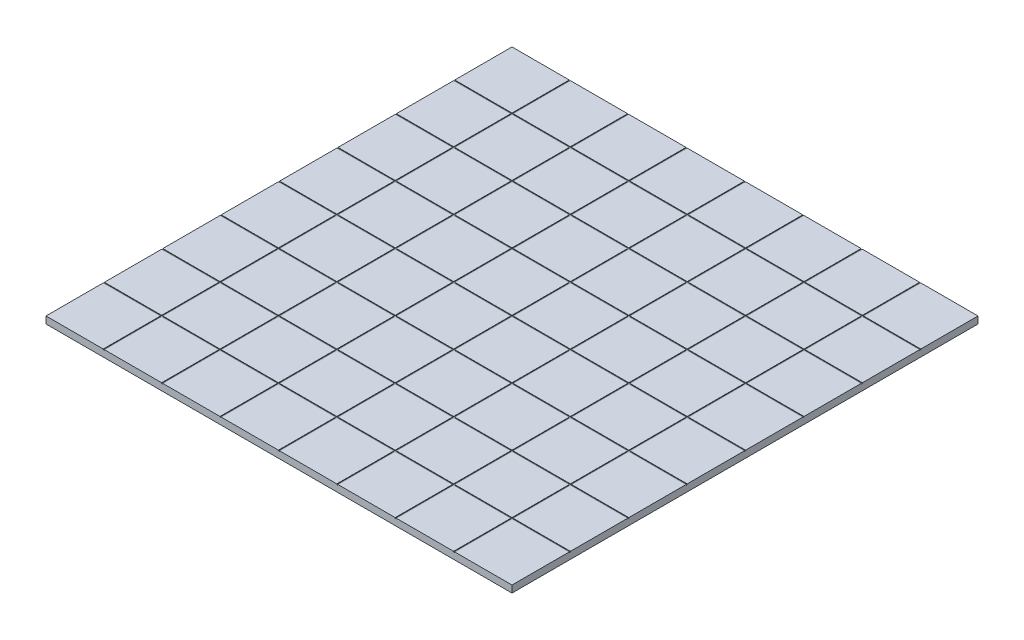
from build123d import *

# Parameters (mm, degrees)
SKETCH1_W           = 200
SKETCH1_H           = 200
BOSS_EXTRUDE1_DEPTH = 3
SKETCH2_W           = 24.5625
SKETCH2_H           = 24.5625
CUT_EXTRUDE1_DEPTH  = 0.25
SKETCH4_W           = 4.4
SKETCH4_H           = 3.5
SKETCH4_W_2         = 3.9
SKETCH4_H_2         = 3
SKETCH4_W_3         = 1.95
SKETCH4_H_3         = 1.5
CUT_EXTRUDE2_DEPTH  = 1.5
SKETCH7_W           = 4.4
SKETCH7_H           = 3.5
SKETCH7_W_2         = 3.4
SKETCH7_H_2         = 2.5
CUT_EXTRUDE4_DEPTH  = 1.25
SKETCH8_W           = 4.5
SKETCH8_H           = 3.74
SKETCH8_W_2         = 4
SKETCH8_H_2         = 3.24
CUT_EXTRUDE5_DEPTH  = 2.75


with BuildPart() as part:
    # Sketch1 → Boss-Extrude1 (new body)
    with BuildSketch(Plane(origin=(0, 0, 0), x_dir=(1, 0, 0), z_dir=(0, 1, 0))):
        with Locations((100, 100)):
            Rectangle(SKETCH1_W, SKETCH1_H)
    extrude(amount=BOSS_EXTRUDE1_DEPTH)

    # Sketch2 → Cut-Extrude1 (cut)
    with BuildSketch(Plane(origin=(0, 3, 0), x_dir=(1, 0, 0), z_dir=(0, 1, 0))):
        Polygon((150.375, 24.5625), (174.9375, 24.5625), (174.9375, 0), (175.4375, 0), (175.4375, 24.5625), (200, 24.5625), (200, 25.0625), (175.4375, 25.0625), (175.4375, 49.625), (200, 49.625), (200, 50.125), (175.4375, 50.125), (175.4375, 74.6875), (200, 74.6875), (200, 75.1875), (175.4375, 75.1875), (175.4375, 99.75), (200, 99.75), (200, 100.25), (175.4375, 100.25), (175.4375, 124.8125), (200, 124.8125), (200, 125.3125), (175.4375, 125.3125), (175.4375, 149.875), (200, 149.875), (200, 150.375), (175.4375, 150.375), (175.4375, 174.9375), (200, 174.9375), (200, 175.4375), (175.4375, 175.4375), (175.4375, 200), (174.9375, 200), (174.9375, 175.4375), (150.375, 175.4375), (150.375, 200), (149.875, 200), (149.875, 175.4375), (125.3125, 175.4375), (125.3125, 200), (124.8125, 200), (124.8125, 175.4375), (100.25, 175.4375), (100.25, 200), (99.75, 200), (99.75, 175.4375), (75.1875, 175.4375), (75.1875, 200), (74.6875, 200), (74.6875, 175.4375), (50.125, 175.4375), (50.125, 200), (49.625, 200), (49.625, 175.4375), (25.0625, 175.4375), (25.0625, 200), (24.5625, 200), (24.5625, 175.4375), (0, 175.4375), (0, 174.9375), (24.5625, 174.9375), (24.5625, 150.375), (0, 150.375), (0, 149.875), (24.5625, 149.875), (24.5625, 125.3125), (0, 125.3125), (0, 124.8125), (24.5625, 124.8125), (24.5625, 100.25), (0, 100.25), (0, 99.75), (24.5625, 99.75), (24.5625, 75.1875), (0, 75.1875), (0, 74.6875), (24.5625, 74.6875), (24.5625, 50.125), (0, 50.125), (0, 49.625), (24.5625, 49.625), (24.5625, 25.0625), (0, 25.0625), (0, 24.5625), (24.5625, 24.5625), (24.5625, 0), (25.0625, 0), (25.0625, 24.5625), (49.625, 24.5625), (49.625, 0), (50.125, 0), (50.125, 24.5625), (74.6875, 24.5625), (74.6875, 0), (75.1875, 0), (75.1875, 24.5625), (99.75, 24.5625), (99.75, 0), (100.25, 0), (100.25, 24.5625), (124.8125, 24.5625), (124.8125, 0), (125.3125, 0), (125.3125, 24.5625), (149.875, 24.5625), (149.875, 0), (150.375, 0), align=None)
        with Locations((37.34375, 37.34375)):
            Rectangle(SKETCH2_W, SKETCH2_H, mode=Mode.SUBTRACT)
        with Locations((62.40625, 37.34375)):
            Rectangle(SKETCH2_W, SKETCH2_H, mode=Mode.SUBTRACT)
        with Locations((37.34375, 62.40625)):
            Rectangle(SKETCH2_W, SKETCH2_H, mode=Mode.SUBTRACT)
        with Locations((62.40625, 62.40625)):
            Rectangle(SKETCH2_W, SKETCH2_H, mode=Mode.SUBTRACT)
        with Locations((87.46875, 37.34375)):
            Rectangle(SKETCH2_W, SKETCH2_H, mode=Mode.SUBTRACT)
        with Locations((87.46875, 62.40625)):
            Rectangle(SKETCH2_W, SKETCH2_H, mode=Mode.SUBTRACT)
        with Locations((37.34375, 87.46875)):
            Rectangle(SKETCH2_W, SKETCH2_H, mode=Mode.SUBTRACT)
        with Locations((62.40625, 87.46875)):
            Rectangle(SKETCH2_W, SKETCH2_H, mode=Mode.SUBTRACT)
        with Locations((87.46875, 87.46875)):
            Rectangle(SKETCH2_W, SKETCH2_H, mode=Mode.SUBTRACT)
        with Locations((112.53125, 37.34375)):
            Rectangle(SKETCH2_W, SKETCH2_H, mode=Mode.SUBTRACT)
        with Locations((112.53125, 62.40625)):
            Rectangle(SKETCH2_W, SKETCH2_H, mode=Mode.SUBTRACT)
        with Locations((137.59375, 37.34375)):
            Rectangle(SKETCH2_W, SKETCH2_H, mode=Mode.SUBTRACT)
        with Locations((162.65625, 37.34375)):
            Rectangle(SKETCH2_W, SKETCH2_H, mode=Mode.SUBTRACT)
        with Locations((137.59375, 62.40625)):
            Rectangle(SKETCH2_W, SKETCH2_H, mode=Mode.SUBTRACT)
        with Locations((162.65625, 62.40625)):
            Rectangle(SKETCH2_W, SKETCH2_H, mode=Mode.SUBTRACT)
        with Locations((112.53125, 87.46875)):
            Rectangle(SKETCH2_W, SKETCH2_H, mode=Mode.SUBTRACT)
        with Locations((137.59375, 87.46875)):
            Rectangle(SKETCH2_W, SKETCH2_H, mode=Mode.SUBTRACT)
        with Locations((162.65625, 87.46875)):
            Rectangle(SKETCH2_W, SKETCH2_H, mode=Mode.SUBTRACT)
        with Locations((37.34375, 112.53125)):
            Rectangle(SKETCH2_W, SKETCH2_H, mode=Mode.SUBTRACT)
        with Locations((62.40625, 112.53125)):
            Rectangle(SKETCH2_W, SKETCH2_H, mode=Mode.SUBTRACT)
        with Locations((87.46875, 112.53125)):
            Rectangle(SKETCH2_W, SKETCH2_H, mode=Mode.SUBTRACT)
        with Locations((37.34375, 137.59375)):
            Rectangle(SKETCH2_W, SKETCH2_H, mode=Mode.SUBTRACT)
        with Locations((62.40625, 137.59375)):
            Rectangle(SKETCH2_W, SKETCH2_H, mode=Mode.SUBTRACT)
        with Locations((37.34375, 162.65625)):
            Rectangle(SKETCH2_W, SKETCH2_H, mode=Mode.SUBTRACT)
        with Locations((62.40625, 162.65625)):
            Rectangle(SKETCH2_W, SKETCH2_H, mode=Mode.SUBTRACT)
        with Locations((87.46875, 137.59375)):
            Rectangle(SKETCH2_W, SKETCH2_H, mode=Mode.SUBTRACT)
        with Locations((87.46875, 162.65625)):
            Rectangle(SKETCH2_W, SKETCH2_H, mode=Mode.SUBTRACT)
        with Locations((112.53125, 112.53125)):
            Rectangle(SKETCH2_W, SKETCH2_H, mode=Mode.SUBTRACT)
        with Locations((137.59375, 112.53125)):
            Rectangle(SKETCH2_W, SKETCH2_H, mode=Mode.SUBTRACT)
        with Locations((162.65625, 112.53125)):
            Rectangle(SKETCH2_W, SKETCH2_H, mode=Mode.SUBTRACT)
        with Locations((112.53125, 137.59375)):
            Rectangle(SKETCH2_W, SKETCH2_H, mode=Mode.SUBTRACT)
        with Locations((112.53125, 162.65625)):
            Rectangle(SKETCH2_W, SKETCH2_H, mode=Mode.SUBTRACT)
        with Locations((137.59375, 137.59375)):
            Rectangle(SKETCH2_W, SKETCH2_H, mode=Mode.SUBTRACT)
        with Locations((162.65625, 137.59375)):
            Rectangle(SKETCH2_W, SKETCH2_H, mode=Mode.SUBTRACT)
        with Locations((137.59375, 162.65625)):
            Rectangle(SKETCH2_W, SKETCH2_H, mode=Mode.SUBTRACT)
        with Locations((162.65625, 162.65625)):
            Rectangle(SKETCH2_W, SKETCH2_H, mode=Mode.SUBTRACT)
    extrude(amount=-CUT_EXTRUDE1_DEPTH, mode=Mode.SUBTRACT)

    # Sketch4 → Cut-Extrude2 (cut)
    # profile 1 of 68: a face of its own
    with BuildSketch(Plane.XZ):
        with Locations((37.3425, -162.6575)):
            Rectangle(SKETCH4_W, SKETCH4_H)
    # profile 2 of 68: a face of its own
    with BuildSketch(Plane.XZ):
        with Locations((12.28, -162.6575)):
            Rectangle(SKETCH4_W, SKETCH4_H)
    # profile 3 of 68: a face of its own
    with BuildSketch(Plane.XZ):
        with Locations((12.28, -187.72)):
            Rectangle(SKETCH4_W, SKETCH4_H)
        with Locations((12.28, -187.72)):
            Rectangle(SKETCH4_W_2, SKETCH4_H_2, mode=Mode.SUBTRACT)
    # profile 4 of 68: a face of its own
    with BuildSketch(Plane.XZ):
        with Locations((13.255, -188.47)):
            Rectangle(SKETCH4_W_3, SKETCH4_H_3)
    # profile 5 of 68: a face of its own
    with BuildSketch(Plane.XZ):
        with Locations((13.255, -186.97)):
            Rectangle(SKETCH4_W_3, SKETCH4_H_3)
    # profile 6 of 68: a face of its own
    with BuildSketch(Plane.XZ):
        with Locations((11.305, -186.97)):
            Rectangle(SKETCH4_W_3, SKETCH4_H_3)
    # profile 7 of 68: a face of its own
    with BuildSketch(Plane.XZ):
        with Locations((11.305, -188.47)):
            Rectangle(SKETCH4_W_3, SKETCH4_H_3)
    # profile 8 of 68: a face of its own
    with BuildSketch(Plane.XZ):
        with Locations((37.3425, -187.72)):
            Rectangle(SKETCH4_W, SKETCH4_H)
    # profile 9 of 68: a face of its own
    with BuildSketch(Plane.XZ):
        with Locations((62.405, -187.72)):
            Rectangle(SKETCH4_W, SKETCH4_H)
    # profile 10 of 68: a face of its own
    with BuildSketch(Plane.XZ):
        with Locations((87.4675, -187.72)):
            Rectangle(SKETCH4_W, SKETCH4_H)
    # profile 11 of 68: a face of its own
    with BuildSketch(Plane.XZ):
        with Locations((112.53, -187.72)):
            Rectangle(SKETCH4_W, SKETCH4_H)
    # profile 12 of 68: a face of its own
    with BuildSketch(Plane.XZ):
        with Locations((137.5925, -187.72)):
            Rectangle(SKETCH4_W, SKETCH4_H)
    # profile 13 of 68: a face of its own
    with BuildSketch(Plane.XZ):
        with Locations((162.655, -187.72)):
            Rectangle(SKETCH4_W, SKETCH4_H)
    # profile 14 of 68: a face of its own
    with BuildSketch(Plane.XZ):
        with Locations((187.7175, -187.72)):
            Rectangle(SKETCH4_W, SKETCH4_H)
    # profile 15 of 68: a face of its own
    with BuildSketch(Plane.XZ):
        with Locations((187.7175, -162.6575)):
            Rectangle(SKETCH4_W, SKETCH4_H)
    # profile 16 of 68: a face of its own
    with BuildSketch(Plane.XZ):
        with Locations((162.655, -162.6575)):
            Rectangle(SKETCH4_W, SKETCH4_H)
    # profile 17 of 68: a face of its own
    with BuildSketch(Plane.XZ):
        with Locations((137.5925, -162.6575)):
            Rectangle(SKETCH4_W, SKETCH4_H)
    # profile 18 of 68: a face of its own
    with BuildSketch(Plane.XZ):
        with Locations((112.53, -162.6575)):
            Rectangle(SKETCH4_W, SKETCH4_H)
    # profile 19 of 68: a face of its own
    with BuildSketch(Plane.XZ):
        with Locations((87.4675, -162.6575)):
            Rectangle(SKETCH4_W, SKETCH4_H)
    # profile 20 of 68: a face of its own
    with BuildSketch(Plane.XZ):
        with Locations((62.405, -162.6575)):
            Rectangle(SKETCH4_W, SKETCH4_H)
    # profile 21 of 68: a face of its own
    with BuildSketch(Plane.XZ):
        with Locations((12.28, -137.595)):
            Rectangle(SKETCH4_W, SKETCH4_H)
    # profile 22 of 68: a face of its own
    with BuildSketch(Plane.XZ):
        with Locations((37.3425, -137.595)):
            Rectangle(SKETCH4_W, SKETCH4_H)
    # profile 23 of 68: a face of its own
    with BuildSketch(Plane.XZ):
        with Locations((62.405, -137.595)):
            Rectangle(SKETCH4_W, SKETCH4_H)
    # profile 24 of 68: a face of its own
    with BuildSketch(Plane.XZ):
        with Locations((87.4675, -137.595)):
            Rectangle(SKETCH4_W, SKETCH4_H)
    # profile 25 of 68: a face of its own
    with BuildSketch(Plane.XZ):
        with Locations((112.53, -137.595)):
            Rectangle(SKETCH4_W, SKETCH4_H)
    # profile 26 of 68: a face of its own
    with BuildSketch(Plane.XZ):
        with Locations((137.5925, -137.595)):
            Rectangle(SKETCH4_W, SKETCH4_H)
    # profile 27 of 68: a face of its own
    with BuildSketch(Plane.XZ):
        with Locations((162.655, -137.595)):
            Rectangle(SKETCH4_W, SKETCH4_H)
    # profile 28 of 68: a face of its own
    with BuildSketch(Plane.XZ):
        with Locations((187.7175, -137.595)):
            Rectangle(SKETCH4_W, SKETCH4_H)
    # profile 29 of 68: a face of its own
    with BuildSketch(Plane.XZ):
        with Locations((187.7175, -112.5325)):
            Rectangle(SKETCH4_W, SKETCH4_H)
    # profile 30 of 68: a face of its own
    with BuildSketch(Plane.XZ):
        with Locations((162.655, -112.5325)):
            Rectangle(SKETCH4_W, SKETCH4_H)
    # profile 31 of 68: a face of its own
    with BuildSketch(Plane.XZ):
        with Locations((137.5925, -112.5325)):
            Rectangle(SKETCH4_W, SKETCH4_H)
    # profile 32 of 68: a face of its own
    with BuildSketch(Plane.XZ):
        with Locations((112.53, -112.5325)):
            Rectangle(SKETCH4_W, SKETCH4_H)
    # profile 33 of 68: a face of its own
    with BuildSketch(Plane.XZ):
        with Locations((87.4675, -112.5325)):
            Rectangle(SKETCH4_W, SKETCH4_H)
    # profile 34 of 68: a face of its own
    with BuildSketch(Plane.XZ):
        with Locations((62.405, -112.5325)):
            Rectangle(SKETCH4_W, SKETCH4_H)
    # profile 35 of 68: a face of its own
    with BuildSketch(Plane.XZ):
        with Locations((37.3425, -112.5325)):
            Rectangle(SKETCH4_W, SKETCH4_H)
    # profile 36 of 68: a face of its own
    with BuildSketch(Plane.XZ):
        with Locations((12.28, -112.5325)):
            Rectangle(SKETCH4_W, SKETCH4_H)
    # profile 37 of 68: a face of its own
    with BuildSketch(Plane.XZ):
        with Locations((12.28, -87.47)):
            Rectangle(SKETCH4_W, SKETCH4_H)
    # profile 38 of 68: a face of its own
    with BuildSketch(Plane.XZ):
        with Locations((37.3425, -87.47)):
            Rectangle(SKETCH4_W, SKETCH4_H)
    # profile 39 of 68: a face of its own
    with BuildSketch(Plane.XZ):
        with Locations((62.405, -87.47)):
            Rectangle(SKETCH4_W, SKETCH4_H)
    # profile 40 of 68: a face of its own
    with BuildSketch(Plane.XZ):
        with Locations((87.4675, -87.47)):
            Rectangle(SKETCH4_W, SKETCH4_H)
    # profile 41 of 68: a face of its own
    with BuildSketch(Plane.XZ):
        with Locations((112.53, -87.47)):
            Rectangle(SKETCH4_W, SKETCH4_H)
    # profile 42 of 68: a face of its own
    with BuildSketch(Plane.XZ):
        with Locations((137.5925, -87.47)):
            Rectangle(SKETCH4_W, SKETCH4_H)
    # profile 43 of 68: a face of its own
    with BuildSketch(Plane.XZ):
        with Locations((162.655, -87.47)):
            Rectangle(SKETCH4_W, SKETCH4_H)
    # profile 44 of 68: a face of its own
    with BuildSketch(Plane.XZ):
        with Locations((187.7175, -87.47)):
            Rectangle(SKETCH4_W, SKETCH4_H)
    # profile 45 of 68: a face of its own
    with BuildSketch(Plane.XZ):
        with Locations((187.7175, -62.4075)):
            Rectangle(SKETCH4_W, SKETCH4_H)
    # profile 46 of 68: a face of its own
    with BuildSketch(Plane.XZ):
        with Locations((162.655, -62.4075)):
            Rectangle(SKETCH4_W, SKETCH4_H)
    # profile 47 of 68: a face of its own
    with BuildSketch(Plane.XZ):
        with Locations((137.5925, -62.4075)):
            Rectangle(SKETCH4_W, SKETCH4_H)
    # profile 48 of 68: a face of its own
    with BuildSketch(Plane.XZ):
        with Locations((112.53, -62.4075)):
            Rectangle(SKETCH4_W, SKETCH4_H)
    # profile 49 of 68: a face of its own
    with BuildSketch(Plane.XZ):
        with Locations((87.4675, -62.4075)):
            Rectangle(SKETCH4_W, SKETCH4_H)
    # profile 50 of 68: a face of its own
    with BuildSketch(Plane.XZ):
        with Locations((62.405, -62.4075)):
            Rectangle(SKETCH4_W, SKETCH4_H)
    # profile 51 of 68: a face of its own
    with BuildSketch(Plane.XZ):
        with Locations((37.3425, -62.4075)):
            Rectangle(SKETCH4_W, SKETCH4_H)
    # profile 52 of 68: a face of its own
    with BuildSketch(Plane.XZ):
        with Locations((12.28, -62.4075)):
            Rectangle(SKETCH4_W, SKETCH4_H)
    # profile 53 of 68: a face of its own
    with BuildSketch(Plane.XZ):
        with Locations((12.28, -37.345)):
            Rectangle(SKETCH4_W, SKETCH4_H)
    # profile 54 of 68: a face of its own
    with BuildSketch(Plane.XZ):
        with Locations((37.3425, -37.345)):
            Rectangle(SKETCH4_W, SKETCH4_H)
    # profile 55 of 68: a face of its own
    with BuildSketch(Plane.XZ):
        with Locations((62.405, -37.345)):
            Rectangle(SKETCH4_W, SKETCH4_H)
    # profile 56 of 68: a face of its own
    with BuildSketch(Plane.XZ):
        with Locations((87.4675, -37.345)):
            Rectangle(SKETCH4_W, SKETCH4_H)
    # profile 57 of 68: a face of its own
    with BuildSketch(Plane.XZ):
        with Locations((112.53, -37.345)):
            Rectangle(SKETCH4_W, SKETCH4_H)
    # profile 58 of 68: a face of its own
    with BuildSketch(Plane.XZ):
        with Locations((137.5925, -37.345)):
            Rectangle(SKETCH4_W, SKETCH4_H)
    # profile 59 of 68: a face of its own
    with BuildSketch(Plane.XZ):
        with Locations((162.655, -37.345)):
            Rectangle(SKETCH4_W, SKETCH4_H)
    # profile 60 of 68: a face of its own
    with BuildSketch(Plane.XZ):
        with Locations((187.7175, -37.345)):
            Rectangle(SKETCH4_W, SKETCH4_H)
    # profile 61 of 68: a face of its own
    with BuildSketch(Plane.XZ):
        with Locations((187.7175, -12.2825)):
            Rectangle(SKETCH4_W, SKETCH4_H)
    # profile 62 of 68: a face of its own
    with BuildSketch(Plane.XZ):
        with Locations((162.655, -12.2825)):
            Rectangle(SKETCH4_W, SKETCH4_H)
    # profile 63 of 68: a face of its own
    with BuildSketch(Plane.XZ):
        with Locations((137.5925, -12.2825)):
            Rectangle(SKETCH4_W, SKETCH4_H)
    # profile 64 of 68: a face of its own
    with BuildSketch(Plane.XZ):
        with Locations((112.53, -12.2825)):
            Rectangle(SKETCH4_W, SKETCH4_H)
    # profile 65 of 68: a face of its own
    with BuildSketch(Plane.XZ):
        with Locations((87.4675, -12.2825)):
            Rectangle(SKETCH4_W, SKETCH4_H)
    # profile 66 of 68: a face of its own
    with BuildSketch(Plane.XZ):
        with Locations((62.405, -12.2825)):
            Rectangle(SKETCH4_W, SKETCH4_H)
    # profile 67 of 68: a face of its own
    with BuildSketch(Plane.XZ):
        with Locations((12.28, -12.2825)):
            Rectangle(SKETCH4_W, SKETCH4_H)
    # profile 68 of 68: a face of its own
    with BuildSketch(Plane.XZ):
        with Locations((37.3425, -12.2825)):
            Rectangle(SKETCH4_W, SKETCH4_H)
    extrude(amount=-CUT_EXTRUDE2_DEPTH, mode=Mode.SUBTRACT)

    # Sketch7 → Cut-Extrude4 (cut)
    # profile 1 of 64: a face of its own
    with BuildSketch(Plane.XZ.offset(-1.5)):
        with Locations((187.7175, -162.6575)):
            Rectangle(SKETCH7_W, SKETCH7_H)
        with Locations((187.7175, -162.6575)):
            Rectangle(SKETCH7_W_2, SKETCH7_H_2, mode=Mode.SUBTRACT)
    # profile 2 of 64: a face of its own
    with BuildSketch(Plane.XZ.offset(-1.5)):
        with Locations((187.7175, -187.72)):
            Rectangle(SKETCH7_W, SKETCH7_H)
        with Locations((187.7175, -187.72)):
            Rectangle(SKETCH7_W_2, SKETCH7_H_2, mode=Mode.SUBTRACT)
    # profile 3 of 64: a face of its own
    with BuildSketch(Plane.XZ.offset(-1.5)):
        with Locations((187.7175, -137.595)):
            Rectangle(SKETCH7_W, SKETCH7_H)
        with Locations((187.7175, -137.595)):
            Rectangle(SKETCH7_W_2, SKETCH7_H_2, mode=Mode.SUBTRACT)
    # profile 4 of 64: a face of its own
    with BuildSketch(Plane.XZ.offset(-1.5)):
        with Locations((187.7175, -112.5325)):
            Rectangle(SKETCH7_W, SKETCH7_H)
        with Locations((187.7175, -112.5325)):
            Rectangle(SKETCH7_W_2, SKETCH7_H_2, mode=Mode.SUBTRACT)
    # profile 5 of 64: a face of its own
    with BuildSketch(Plane.XZ.offset(-1.5)):
        with Locations((187.7175, -87.47)):
            Rectangle(SKETCH7_W, SKETCH7_H)
        with Locations((187.7175, -87.47)):
            Rectangle(SKETCH7_W_2, SKETCH7_H_2, mode=Mode.SUBTRACT)
    # profile 6 of 64: a face of its own
    with BuildSketch(Plane.XZ.offset(-1.5)):
        with Locations((187.7175, -62.4075)):
            Rectangle(SKETCH7_W, SKETCH7_H)
        with Locations((187.7175, -62.4075)):
            Rectangle(SKETCH7_W_2, SKETCH7_H_2, mode=Mode.SUBTRACT)
    # profile 7 of 64: a face of its own
    with BuildSketch(Plane.XZ.offset(-1.5)):
        with Locations((187.7175, -37.345)):
            Rectangle(SKETCH7_W, SKETCH7_H)
        with Locations((187.7175, -37.345)):
            Rectangle(SKETCH7_W_2, SKETCH7_H_2, mode=Mode.SUBTRACT)
    # profile 8 of 64: a face of its own
    with BuildSketch(Plane.XZ.offset(-1.5)):
        with Locations((187.7175, -12.2825)):
            Rectangle(SKETCH7_W, SKETCH7_H)
        with Locations((187.7175, -12.2825)):
            Rectangle(SKETCH7_W_2, SKETCH7_H_2, mode=Mode.SUBTRACT)
    # profile 9 of 64: a face of its own
    with BuildSketch(Plane.XZ.offset(-1.5)):
        with Locations((162.655, -162.6575)):
            Rectangle(SKETCH7_W, SKETCH7_H)
        with Locations((162.655, -162.6575)):
            Rectangle(SKETCH7_W_2, SKETCH7_H_2, mode=Mode.SUBTRACT)
    # profile 10 of 64: a face of its own
    with BuildSketch(Plane.XZ.offset(-1.5)):
        with Locations((162.655, -137.595)):
            Rectangle(SKETCH7_W, SKETCH7_H)
        with Locations((162.655, -137.595)):
            Rectangle(SKETCH7_W_2, SKETCH7_H_2, mode=Mode.SUBTRACT)
    # profile 11 of 64: a face of its own
    with BuildSketch(Plane.XZ.offset(-1.5)):
        with Locations((162.655, -112.5325)):
            Rectangle(SKETCH7_W, SKETCH7_H)
        with Locations((162.655, -112.5325)):
            Rectangle(SKETCH7_W_2, SKETCH7_H_2, mode=Mode.SUBTRACT)
    # profile 12 of 64: a face of its own
    with BuildSketch(Plane.XZ.offset(-1.5)):
        with Locations((162.655, -87.47)):
            Rectangle(SKETCH7_W, SKETCH7_H)
        with Locations((162.655, -87.47)):
            Rectangle(SKETCH7_W_2, SKETCH7_H_2, mode=Mode.SUBTRACT)
    # profile 13 of 64: a face of its own
    with BuildSketch(Plane.XZ.offset(-1.5)):
        with Locations((162.655, -62.4075)):
            Rectangle(SKETCH7_W, SKETCH7_H)
        with Locations((162.655, -62.4075)):
            Rectangle(SKETCH7_W_2, SKETCH7_H_2, mode=Mode.SUBTRACT)
    # profile 14 of 64: a face of its own
    with BuildSketch(Plane.XZ.offset(-1.5)):
        with Locations((162.655, -37.345)):
            Rectangle(SKETCH7_W, SKETCH7_H)
        with Locations((162.655, -37.345)):
            Rectangle(SKETCH7_W_2, SKETCH7_H_2, mode=Mode.SUBTRACT)
    # profile 15 of 64: a face of its own
    with BuildSketch(Plane.XZ.offset(-1.5)):
        with Locations((162.655, -12.2825)):
            Rectangle(SKETCH7_W, SKETCH7_H)
        with Locations((162.655, -12.2825)):
            Rectangle(SKETCH7_W_2, SKETCH7_H_2, mode=Mode.SUBTRACT)
    # profile 16 of 64: a face of its own
    with BuildSketch(Plane.XZ.offset(-1.5)):
        with Locations((137.5925, -162.6575)):
            Rectangle(SKETCH7_W, SKETCH7_H)
        with Locations((137.5925, -162.6575)):
            Rectangle(SKETCH7_W_2, SKETCH7_H_2, mode=Mode.SUBTRACT)
    # profile 17 of 64: a face of its own
    with BuildSketch(Plane.XZ.offset(-1.5)):
        with Locations((137.5925, -137.595)):
            Rectangle(SKETCH7_W, SKETCH7_H)
        with Locations((137.5925, -137.595)):
            Rectangle(SKETCH7_W_2, SKETCH7_H_2, mode=Mode.SUBTRACT)
    # profile 18 of 64: a face of its own
    with BuildSketch(Plane.XZ.offset(-1.5)):
        with Locations((137.5925, -112.5325)):
            Rectangle(SKETCH7_W, SKETCH7_H)
        with Locations((137.5925, -112.5325)):
            Rectangle(SKETCH7_W_2, SKETCH7_H_2, mode=Mode.SUBTRACT)
    # profile 19 of 64: a face of its own
    with BuildSketch(Plane.XZ.offset(-1.5)):
        with Locations((137.5925, -87.47)):
            Rectangle(SKETCH7_W, SKETCH7_H)
        with Locations((137.5925, -87.47)):
            Rectangle(SKETCH7_W_2, SKETCH7_H_2, mode=Mode.SUBTRACT)
    # profile 20 of 64: a face of its own
    with BuildSketch(Plane.XZ.offset(-1.5)):
        with Locations((137.5925, -62.4075)):
            Rectangle(SKETCH7_W, SKETCH7_H)
        with Locations((137.5925, -62.4075)):
            Rectangle(SKETCH7_W_2, SKETCH7_H_2, mode=Mode.SUBTRACT)
    # profile 21 of 64: a face of its own
    with BuildSketch(Plane.XZ.offset(-1.5)):
        with Locations((137.5925, -37.345)):
            Rectangle(SKETCH7_W, SKETCH7_H)
        with Locations((137.5925, -37.345)):
            Rectangle(SKETCH7_W_2, SKETCH7_H_2, mode=Mode.SUBTRACT)
    # profile 22 of 64: a face of its own
    with BuildSketch(Plane.XZ.offset(-1.5)):
        with Locations((137.5925, -12.2825)):
            Rectangle(SKETCH7_W, SKETCH7_H)
        with Locations((137.5925, -12.2825)):
            Rectangle(SKETCH7_W_2, SKETCH7_H_2, mode=Mode.SUBTRACT)
    # profile 23 of 64: a face of its own
    with BuildSketch(Plane.XZ.offset(-1.5)):
        with Locations((112.53, -162.6575)):
            Rectangle(SKETCH7_W, SKETCH7_H)
        with Locations((112.53, -162.6575)):
            Rectangle(SKETCH7_W_2, SKETCH7_H_2, mode=Mode.SUBTRACT)
    # profile 24 of 64: a face of its own
    with BuildSketch(Plane.XZ.offset(-1.5)):
        with Locations((112.53, -137.595)):
            Rectangle(SKETCH7_W, SKETCH7_H)
        with Locations((112.53, -137.595)):
            Rectangle(SKETCH7_W_2, SKETCH7_H_2, mode=Mode.SUBTRACT)
    # profile 25 of 64: a face of its own
    with BuildSketch(Plane.XZ.offset(-1.5)):
        with Locations((112.53, -112.5325)):
            Rectangle(SKETCH7_W, SKETCH7_H)
        with Locations((112.53, -112.5325)):
            Rectangle(SKETCH7_W_2, SKETCH7_H_2, mode=Mode.SUBTRACT)
    # profile 26 of 64: a face of its own
    with BuildSketch(Plane.XZ.offset(-1.5)):
        with Locations((112.53, -87.47)):
            Rectangle(SKETCH7_W, SKETCH7_H)
        with Locations((112.53, -87.47)):
            Rectangle(SKETCH7_W_2, SKETCH7_H_2, mode=Mode.SUBTRACT)
    # profile 27 of 64: a face of its own
    with BuildSketch(Plane.XZ.offset(-1.5)):
        with Locations((112.53, -62.4075)):
            Rectangle(SKETCH7_W, SKETCH7_H)
        with Locations((112.53, -62.4075)):
            Rectangle(SKETCH7_W_2, SKETCH7_H_2, mode=Mode.SUBTRACT)
    # profile 28 of 64: a face of its own
    with BuildSketch(Plane.XZ.offset(-1.5)):
        with Locations((112.53, -37.345)):
            Rectangle(SKETCH7_W, SKETCH7_H)
        with Locations((112.53, -37.345)):
            Rectangle(SKETCH7_W_2, SKETCH7_H_2, mode=Mode.SUBTRACT)
    # profile 29 of 64: a face of its own
    with BuildSketch(Plane.XZ.offset(-1.5)):
        with Locations((112.53, -12.2825)):
            Rectangle(SKETCH7_W, SKETCH7_H)
        with Locations((112.53, -12.2825)):
            Rectangle(SKETCH7_W_2, SKETCH7_H_2, mode=Mode.SUBTRACT)
    # profile 30 of 64: a face of its own
    with BuildSketch(Plane.XZ.offset(-1.5)):
        with Locations((87.4675, -162.6575)):
            Rectangle(SKETCH7_W, SKETCH7_H)
        with Locations((87.4675, -162.6575)):
            Rectangle(SKETCH7_W_2, SKETCH7_H_2, mode=Mode.SUBTRACT)
    # profile 31 of 64: a face of its own
    with BuildSketch(Plane.XZ.offset(-1.5)):
        with Locations((87.4675, -137.595)):
            Rectangle(SKETCH7_W, SKETCH7_H)
        with Locations((87.4675, -137.595)):
            Rectangle(SKETCH7_W_2, SKETCH7_H_2, mode=Mode.SUBTRACT)
    # profile 32 of 64: a face of its own
    with BuildSketch(Plane.XZ.offset(-1.5)):
        with Locations((87.4675, -112.5325)):
            Rectangle(SKETCH7_W, SKETCH7_H)
        with Locations((87.4675, -112.5325)):
            Rectangle(SKETCH7_W_2, SKETCH7_H_2, mode=Mode.SUBTRACT)
    # profile 33 of 64: a face of its own
    with BuildSketch(Plane.XZ.offset(-1.5)):
        with Locations((87.4675, -87.47)):
            Rectangle(SKETCH7_W, SKETCH7_H)
        with Locations((87.4675, -87.47)):
            Rectangle(SKETCH7_W_2, SKETCH7_H_2, mode=Mode.SUBTRACT)
    # profile 34 of 64: a face of its own
    with BuildSketch(Plane.XZ.offset(-1.5)):
        with Locations((87.4675, -62.4075)):
            Rectangle(SKETCH7_W, SKETCH7_H)
        with Locations((87.4675, -62.4075)):
            Rectangle(SKETCH7_W_2, SKETCH7_H_2, mode=Mode.SUBTRACT)
    # profile 35 of 64: a face of its own
    with BuildSketch(Plane.XZ.offset(-1.5)):
        with Locations((87.4675, -37.345)):
            Rectangle(SKETCH7_W, SKETCH7_H)
        with Locations((87.4675, -37.345)):
            Rectangle(SKETCH7_W_2, SKETCH7_H_2, mode=Mode.SUBTRACT)
    # profile 36 of 64: a face of its own
    with BuildSketch(Plane.XZ.offset(-1.5)):
        with Locations((87.4675, -12.2825)):
            Rectangle(SKETCH7_W, SKETCH7_H)
        with Locations((87.4675, -12.2825)):
            Rectangle(SKETCH7_W_2, SKETCH7_H_2, mode=Mode.SUBTRACT)
    # profile 37 of 64: a face of its own
    with BuildSketch(Plane.XZ.offset(-1.5)):
        with Locations((62.405, -162.6575)):
            Rectangle(SKETCH7_W, SKETCH7_H)
        with Locations((62.405, -162.6575)):
            Rectangle(SKETCH7_W_2, SKETCH7_H_2, mode=Mode.SUBTRACT)
    # profile 38 of 64: a face of its own
    with BuildSketch(Plane.XZ.offset(-1.5)):
        with Locations((62.405, -137.595)):
            Rectangle(SKETCH7_W, SKETCH7_H)
        with Locations((62.405, -137.595)):
            Rectangle(SKETCH7_W_2, SKETCH7_H_2, mode=Mode.SUBTRACT)
    # profile 39 of 64: a face of its own
    with BuildSketch(Plane.XZ.offset(-1.5)):
        with Locations((62.405, -112.5325)):
            Rectangle(SKETCH7_W, SKETCH7_H)
        with Locations((62.405, -112.5325)):
            Rectangle(SKETCH7_W_2, SKETCH7_H_2, mode=Mode.SUBTRACT)
    # profile 40 of 64: a face of its own
    with BuildSketch(Plane.XZ.offset(-1.5)):
        with Locations((62.405, -87.47)):
            Rectangle(SKETCH7_W, SKETCH7_H)
        with Locations((62.405, -87.47)):
            Rectangle(SKETCH7_W_2, SKETCH7_H_2, mode=Mode.SUBTRACT)
    # profile 41 of 64: a face of its own
    with BuildSketch(Plane.XZ.offset(-1.5)):
        with Locations((62.405, -62.4075)):
            Rectangle(SKETCH7_W, SKETCH7_H)
        with Locations((62.405, -62.4075)):
            Rectangle(SKETCH7_W_2, SKETCH7_H_2, mode=Mode.SUBTRACT)
    # profile 42 of 64: a face of its own
    with BuildSketch(Plane.XZ.offset(-1.5)):
        with Locations((62.405, -37.345)):
            Rectangle(SKETCH7_W, SKETCH7_H)
        with Locations((62.405, -37.345)):
            Rectangle(SKETCH7_W_2, SKETCH7_H_2, mode=Mode.SUBTRACT)
    # profile 43 of 64: a face of its own
    with BuildSketch(Plane.XZ.offset(-1.5)):
        with Locations((62.405, -12.2825)):
            Rectangle(SKETCH7_W, SKETCH7_H)
        with Locations((62.405, -12.2825)):
            Rectangle(SKETCH7_W_2, SKETCH7_H_2, mode=Mode.SUBTRACT)
    # profile 44 of 64: a face of its own
    with BuildSketch(Plane.XZ.offset(-1.5)):
        with Locations((37.3425, -162.6575)):
            Rectangle(SKETCH7_W, SKETCH7_H)
        with Locations((37.3425, -162.6575)):
            Rectangle(SKETCH7_W_2, SKETCH7_H_2, mode=Mode.SUBTRACT)
    # profile 45 of 64: a face of its own
    with BuildSketch(Plane.XZ.offset(-1.5)):
        with Locations((37.3425, -137.595)):
            Rectangle(SKETCH7_W, SKETCH7_H)
        with Locations((37.3425, -137.595)):
            Rectangle(SKETCH7_W_2, SKETCH7_H_2, mode=Mode.SUBTRACT)
    # profile 46 of 64: a face of its own
    with BuildSketch(Plane.XZ.offset(-1.5)):
        with Locations((37.3425, -112.5325)):
            Rectangle(SKETCH7_W, SKETCH7_H)
        with Locations((37.3425, -112.5325)):
            Rectangle(SKETCH7_W_2, SKETCH7_H_2, mode=Mode.SUBTRACT)
    # profile 47 of 64: a face of its own
    with BuildSketch(Plane.XZ.offset(-1.5)):
        with Locations((37.3425, -87.47)):
            Rectangle(SKETCH7_W, SKETCH7_H)
        with Locations((37.3425, -87.47)):
            Rectangle(SKETCH7_W_2, SKETCH7_H_2, mode=Mode.SUBTRACT)
    # profile 48 of 64: a face of its own
    with BuildSketch(Plane.XZ.offset(-1.5)):
        with Locations((37.3425, -62.4075)):
            Rectangle(SKETCH7_W, SKETCH7_H)
        with Locations((37.3425, -62.4075)):
            Rectangle(SKETCH7_W_2, SKETCH7_H_2, mode=Mode.SUBTRACT)
    # profile 49 of 64: a face of its own
    with BuildSketch(Plane.XZ.offset(-1.5)):
        with Locations((37.3425, -37.345)):
            Rectangle(SKETCH7_W, SKETCH7_H)
        with Locations((37.3425, -37.345)):
            Rectangle(SKETCH7_W_2, SKETCH7_H_2, mode=Mode.SUBTRACT)
    # profile 50 of 64: a face of its own
    with BuildSketch(Plane.XZ.offset(-1.5)):
        with Locations((37.3425, -12.2825)):
            Rectangle(SKETCH7_W, SKETCH7_H)
        with Locations((37.3425, -12.2825)):
            Rectangle(SKETCH7_W_2, SKETCH7_H_2, mode=Mode.SUBTRACT)
    # profile 51 of 64: a face of its own
    with BuildSketch(Plane.XZ.offset(-1.5)):
        with Locations((12.28, -162.6575)):
            Rectangle(SKETCH7_W, SKETCH7_H)
        with Locations((12.28, -162.6575)):
            Rectangle(SKETCH7_W_2, SKETCH7_H_2, mode=Mode.SUBTRACT)
    # profile 52 of 64: a face of its own
    with BuildSketch(Plane.XZ.offset(-1.5)):
        with Locations((12.28, -137.595)):
            Rectangle(SKETCH7_W, SKETCH7_H)
        with Locations((12.28, -137.595)):
            Rectangle(SKETCH7_W_2, SKETCH7_H_2, mode=Mode.SUBTRACT)
    # profile 53 of 64: a face of its own
    with BuildSketch(Plane.XZ.offset(-1.5)):
        with Locations((12.28, -112.5325)):
            Rectangle(SKETCH7_W, SKETCH7_H)
        with Locations((12.28, -112.5325)):
            Rectangle(SKETCH7_W_2, SKETCH7_H_2, mode=Mode.SUBTRACT)
    # profile 54 of 64: a face of its own
    with BuildSketch(Plane.XZ.offset(-1.5)):
        with Locations((12.28, -87.47)):
            Rectangle(SKETCH7_W, SKETCH7_H)
        with Locations((12.28, -87.47)):
            Rectangle(SKETCH7_W_2, SKETCH7_H_2, mode=Mode.SUBTRACT)
    # profile 55 of 64: a face of its own
    with BuildSketch(Plane.XZ.offset(-1.5)):
        with Locations((12.28, -62.4075)):
            Rectangle(SKETCH7_W, SKETCH7_H)
        with Locations((12.28, -62.4075)):
            Rectangle(SKETCH7_W_2, SKETCH7_H_2, mode=Mode.SUBTRACT)
    # profile 56 of 64: a face of its own
    with BuildSketch(Plane.XZ.offset(-1.5)):
        with Locations((12.28, -37.345)):
            Rectangle(SKETCH7_W, SKETCH7_H)
        with Locations((12.28, -37.345)):
            Rectangle(SKETCH7_W_2, SKETCH7_H_2, mode=Mode.SUBTRACT)
    # profile 57 of 64: a face of its own
    with BuildSketch(Plane.XZ.offset(-1.5)):
        with Locations((12.28, -12.2825)):
            Rectangle(SKETCH7_W, SKETCH7_H)
        with Locations((12.28, -12.2825)):
            Rectangle(SKETCH7_W_2, SKETCH7_H_2, mode=Mode.SUBTRACT)
    # profile 58 of 64: a face of its own
    with BuildSketch(Plane.XZ.offset(-1.5)):
        with Locations((162.655, -187.72)):
            Rectangle(SKETCH7_W, SKETCH7_H)
        with Locations((162.655, -187.72)):
            Rectangle(SKETCH7_W_2, SKETCH7_H_2, mode=Mode.SUBTRACT)
    # profile 59 of 64: a face of its own
    with BuildSketch(Plane.XZ.offset(-1.5)):
        with Locations((137.5925, -187.72)):
            Rectangle(SKETCH7_W, SKETCH7_H)
        with Locations((137.5925, -187.72)):
            Rectangle(SKETCH7_W_2, SKETCH7_H_2, mode=Mode.SUBTRACT)
    # profile 60 of 64: a face of its own
    with BuildSketch(Plane.XZ.offset(-1.5)):
        with Locations((112.53, -187.72)):
            Rectangle(SKETCH7_W, SKETCH7_H)
        with Locations((112.53, -187.72)):
            Rectangle(SKETCH7_W_2, SKETCH7_H_2, mode=Mode.SUBTRACT)
    # profile 61 of 64: a face of its own
    with BuildSketch(Plane.XZ.offset(-1.5)):
        with Locations((87.4675, -187.72)):
            Rectangle(SKETCH7_W, SKETCH7_H)
        with Locations((87.4675, -187.72)):
            Rectangle(SKETCH7_W_2, SKETCH7_H_2, mode=Mode.SUBTRACT)
    # profile 62 of 64: a face of its own
    with BuildSketch(Plane.XZ.offset(-1.5)):
        with Locations((62.405, -187.72)):
            Rectangle(SKETCH7_W, SKETCH7_H)
        with Locations((62.405, -187.72)):
            Rectangle(SKETCH7_W_2, SKETCH7_H_2, mode=Mode.SUBTRACT)
    # profile 63 of 64: a face of its own
    with BuildSketch(Plane.XZ.offset(-1.5)):
        with Locations((37.3425, -187.72)):
            Rectangle(SKETCH7_W, SKETCH7_H)
        with Locations((37.3425, -187.72)):
            Rectangle(SKETCH7_W_2, SKETCH7_H_2, mode=Mode.SUBTRACT)
    # profile 64 of 64: a face of its own
    with BuildSketch(Plane.XZ.offset(-1.5)):
        with Locations((12.28, -187.72)):
            Rectangle(SKETCH7_W, SKETCH7_H)
        with Locations((12.28, -187.72)):
            Rectangle(SKETCH7_W_2, SKETCH7_H_2, mode=Mode.SUBTRACT)
    extrude(amount=-CUT_EXTRUDE4_DEPTH, mode=Mode.SUBTRACT)

    # Sketch8 → Cut-Extrude5 (cut)
    # profile 1 of 2: a face of its own
    with BuildSketch(Plane.XZ):
        with Locations((12.28, -17.6525)):
            Rectangle(SKETCH8_W, SKETCH8_H)
        with Locations((12.28, -17.6525)):
            Rectangle(SKETCH8_W_2, SKETCH8_H_2, mode=Mode.SUBTRACT)
    # profile 2 of 2: a face of its own
    with BuildSketch(Plane.XZ):
        with Locations((12.28, -17.6525)):
            Rectangle(SKETCH8_W_2, SKETCH8_H_2)
    extrude(amount=-CUT_EXTRUDE5_DEPTH, mode=Mode.SUBTRACT)


solid = part.part
